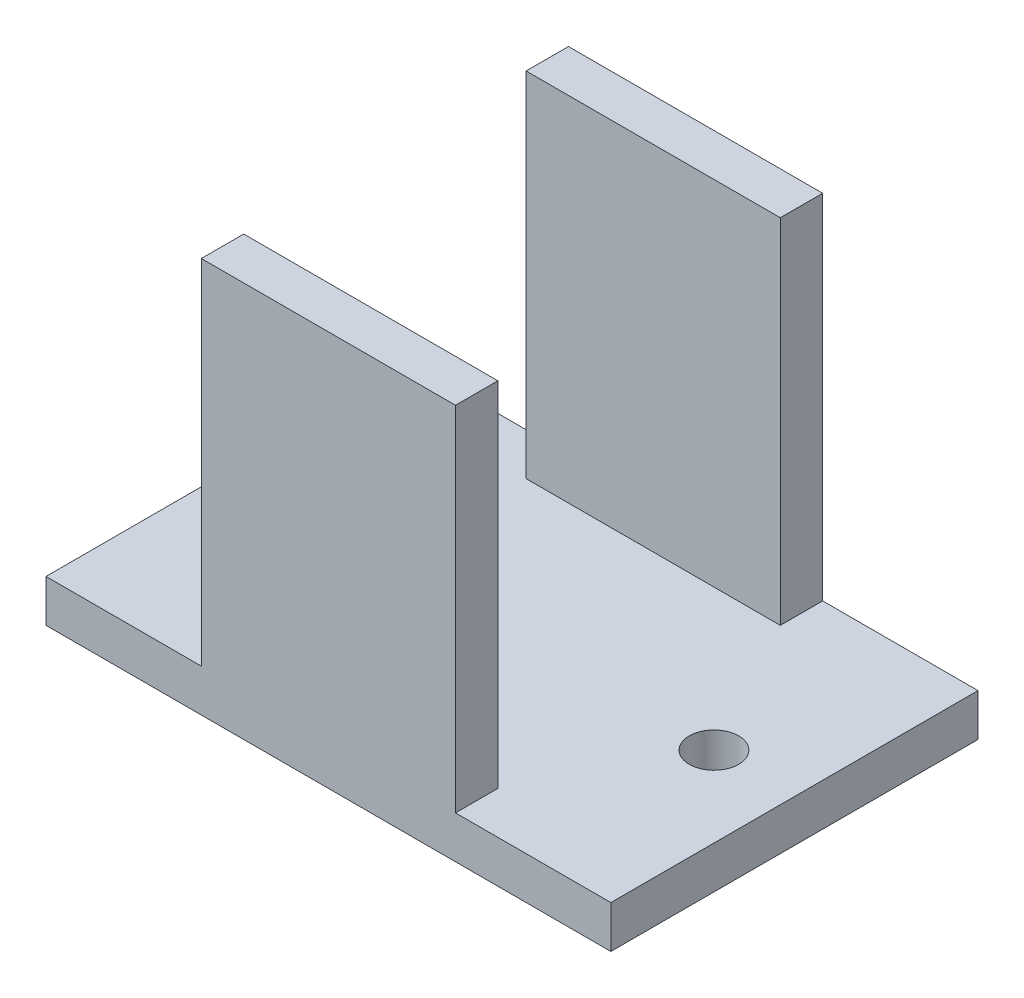
from build123d import *

# Parameters (mm, degrees)
SKETCH1_W           = 40
SKETCH1_H           = 26
BOSS_EXTRUDE1_DEPTH = 3
SKETCH2_R           = 1.75
CUT_EXTRUDE1_DEPTH  = 3
SKETCH3_W           = 18
SKETCH3_H           = 3
BOSS_EXTRUDE2_DEPTH = 25


with BuildPart() as part:
    # Sketch1 → Boss-Extrude1 (new body)
    with BuildSketch(Plane(origin=(0, 0, 0), x_dir=(1, 0, 0), z_dir=(0, 1, 0))):
        Rectangle(SKETCH1_W, SKETCH1_H)
    extrude(amount=BOSS_EXTRUDE1_DEPTH)

    # Sketch2 → Cut-Extrude1 (cut)
    with BuildSketch(Plane(origin=(0, 3, 0), x_dir=(1, 0, 0), z_dir=(0, 1, 0))):
        with Locations((14.3, 0)):
            Circle(SKETCH2_R)
        with Locations((-14.3, 0)):
            Circle(SKETCH2_R)
    extrude(amount=-CUT_EXTRUDE1_DEPTH, mode=Mode.SUBTRACT)

    # Sketch3 → Boss-Extrude2 (add)
    with BuildSketch(Plane(origin=(0, 3, 0), x_dir=(1, 0, 0), z_dir=(0, 1, 0))):
        with Locations((0, -11.5)):
            Rectangle(SKETCH3_W, SKETCH3_H)
        with Locations((0, 11.5)):
            Rectangle(SKETCH3_W, SKETCH3_H)
    extrude(amount=BOSS_EXTRUDE2_DEPTH)


solid = part.part
